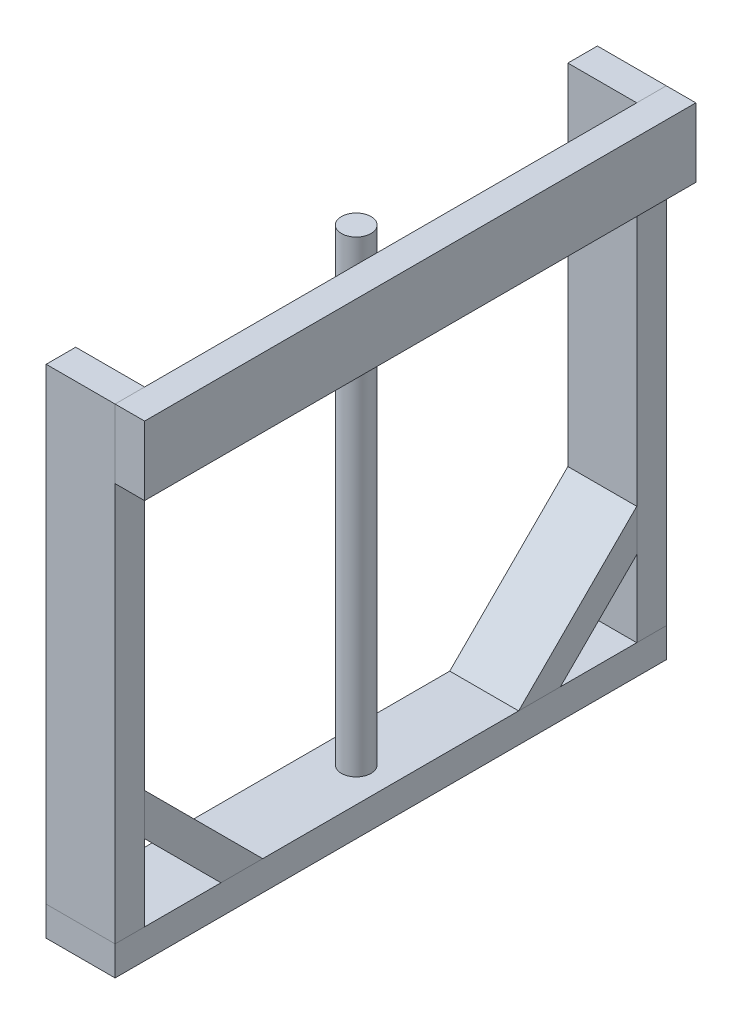
from build123d import *

# Parameters (mm, degrees)
SKETCH1_W                  = 711.2
SKETCH1_H                  = 88.9
TOP_CROSS_SUPPORT_DEPTH    = 38.1
SKETCH2_W                  = 38.1
SKETCH2_H                  = 603.25
LEG_DEPTH                  = 88.9
SKETCH4_W                  = 88.9
SKETCH4_H                  = 711.2
BOTTOM_CROSS_SUPPORT_DEPTH = 38.1
LOW_DIAGONAL_SUPPORT_DEPTH = 88.9
SKETCH6_R                  = 19.05
ACTUATOR_DEPTH             = 603.25


with BuildPart() as part:
    # Sketch1 → Top_Cross_Support (new body)
    with BuildSketch(Plane(origin=(0, 0, 0), x_dir=(0, 0, -1), z_dir=(1, 0, 0))):
        with Locations((0, -44.45)):
            Rectangle(SKETCH1_W, SKETCH1_H)
    extrude(amount=TOP_CROSS_SUPPORT_DEPTH)


with BuildPart() as body_2:
    # Sketch2 → Leg (new body)
    with BuildSketch(Plane.ZY):
        with Locations((336.55, -301.625)):
            Rectangle(SKETCH2_W, SKETCH2_H)
    extrude(amount=LEG_DEPTH)


with BuildPart() as body_3:
    # Leg_Mirror: mirrored copy
    add(body_2.part.mirror(Plane.XY))


with BuildPart() as body_4:
    # Sketch4 → Bottom_Cross_Support (new body)
    with BuildSketch(Plane.XZ.offset(603.25)):
        with Locations((-44.45, 0)):
            Rectangle(SKETCH4_W, SKETCH4_H)
    extrude(amount=BOTTOM_CROSS_SUPPORT_DEPTH)


with BuildPart() as body_5:
    # Sketch5 → Low_Diagonal_Support (new body)
    with BuildSketch(Plane(origin=(0, 0, 0), x_dir=(0, 0, -1), z_dir=(1, 0, 0))):
        Polygon((-218.981536726, -603.25), (-317.5, -504.731536726), (-317.5, -450.85), (-165.1, -603.25), align=None)
    extrude(amount=-LOW_DIAGONAL_SUPPORT_DEPTH)


with BuildPart() as body_6:
    # Low_Diagonal_Support_Mirror: mirrored copy
    add(body_5.part.mirror(Plane.XY))


with BuildPart() as body_7:
    # Sketch6 → Actuator (new body)
    with BuildSketch(Plane(origin=(0, -603.25, 0), x_dir=(1, 0, 0), z_dir=(0, 1, 0))):
        with Locations((-44.45, 0)):
            Circle(SKETCH6_R)
    extrude(amount=ACTUATOR_DEPTH)


solid = Compound([part.part, body_2.part, body_3.part, body_4.part, body_5.part, body_6.part, body_7.part])
